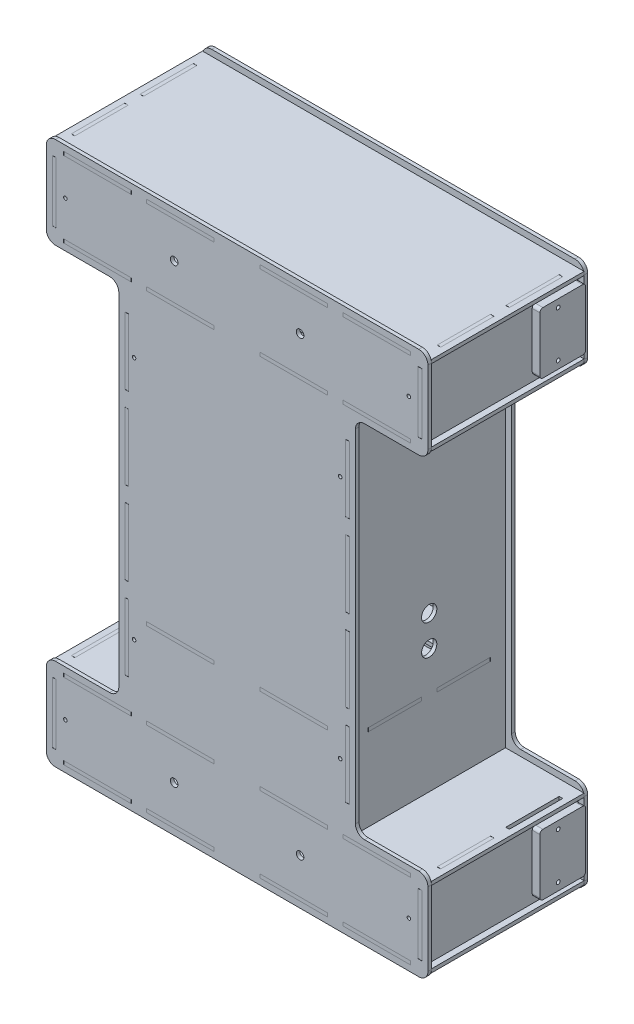
from build123d import *

# Parameters (mm, degrees)
SKETCH2_R           = 15.875
SKETCH2_R_2         = 1.4732
SKETCH2_W           = 56.2991
SKETCH2_H           = 2.9718
SKETCH2_W_2         = 2.9718
SKETCH2_H_2         = 50.8
SKETCH2_H_3         = 55.88
BOSS_EXTRUDE1_DEPTH = 2.9718
FILLET1_R           = 7.62
SKETCH3_R           = 3.175
SKETCH3_R_2         = 1.4732
SKETCH3_W           = 56.2991
SKETCH3_H           = 2.9718
SKETCH3_W_2         = 2.9718
SKETCH3_H_2         = 50.8
SKETCH3_H_3         = 55.88
BOSS_EXTRUDE2_DEPTH = 2.9718
SKETCH4_W           = 2.9718
SKETCH4_H           = 44.45
BOSS_EXTRUDE4_DEPTH = 2.9718
LPATTERN1_COUNT     = 2
LPATTERN1_PITCH     = 63.0682
SKETCH6_W           = 2.9718
SKETCH6_H           = 44.45
CUT_EXTRUDE1_DEPTH  = 433.729975037
CUT_EXTRUDE2_DEPTH  = 433.729975037
BOSS_EXTRUDE5_DEPTH = 2.9718
SKETCH15_W          = 38.1
SKETCH15_H          = 50.8
SKETCH15_R          = 1.5875
BOSS_EXTRUDE9_DEPTH = 6.35
SKETCH16_R          = 1.5875
CUT_EXTRUDE7_DEPTH  = 407.9423163
FILLET2_R           = 2.54
BOSS_EXTRUDE6_DEPTH = 2.9718
SKETCH10_W          = 44.45
SKETCH10_H          = 2.9718
CUT_EXTRUDE3_DEPTH  = 364.578898755
BOSS_EXTRUDE7_DEPTH = 2.9718
SKETCH12_R          = 1.4732
CUT_EXTRUDE4_DEPTH  = 372.829608394
CUT_EXTRUDE5_DEPTH  = 372.829608394
SKETCH14_R          = 6.35
SKETCH14_R_2        = 1.8288
CUT_EXTRUDE6_DEPTH  = 434.197494447
SKETCH17_R          = 1.4732
CUT_EXTRUDE8_DEPTH  = 308.21901761
SKETCH19_R          = 6.35
CUT_EXTRUDE9_DEPTH  = 362.514241769


with BuildPart() as part:
    # Sketch2 → Boss-Extrude1 (new body)
    with BuildSketch(Plane.XY):
        Polygon((-98.425, 149.86), (-98.425, -149.86), (-158.75, -149.86), (-158.75, -226.06), (158.75, -226.06), (158.75, -149.86), (98.425, -149.86), (98.425, 149.86), (158.75, 149.86), (158.75, 226.06), (-158.75, 226.06), (-158.75, 149.86), align=None)
        with Locations((66.675, 187.96)):
            Circle(SKETCH2_R, mode=Mode.SUBTRACT)
        with Locations((22.225, 187.96)):
            Circle(SKETCH2_R, mode=Mode.SUBTRACT)
        with Locations((-22.225, 187.96)):
            Circle(SKETCH2_R, mode=Mode.SUBTRACT)
        with Locations((-66.675, 187.96)):
            Circle(SKETCH2_R, mode=Mode.SUBTRACT)
        with Locations((111.125, 187.96)):
            Circle(SKETCH2_R, mode=Mode.SUBTRACT)
        with Locations((-111.125, 187.96)):
            Circle(SKETCH2_R, mode=Mode.SUBTRACT)
        with Locations((-22.225, -187.96)):
            Circle(SKETCH2_R, mode=Mode.SUBTRACT)
        with Locations((22.225, -187.96)):
            Circle(SKETCH2_R, mode=Mode.SUBTRACT)
        with Locations((66.675, -187.96)):
            Circle(SKETCH2_R, mode=Mode.SUBTRACT)
        with Locations((111.125, -187.96)):
            Circle(SKETCH2_R, mode=Mode.SUBTRACT)
        with Locations((-142.875, 187.96)):
            Circle(SKETCH2_R_2, mode=Mode.SUBTRACT)
        with Locations((-111.125, -187.96)):
            Circle(SKETCH2_R, mode=Mode.SUBTRACT)
        with Locations((-66.675, -187.96)):
            Circle(SKETCH2_R, mode=Mode.SUBTRACT)
        with Locations((142.875, 187.96)):
            Circle(SKETCH2_R_2, mode=Mode.SUBTRACT)
        with Locations((142.875, -187.96)):
            Circle(SKETCH2_R_2, mode=Mode.SUBTRACT)
        with Locations((-142.875, -187.96)):
            Circle(SKETCH2_R_2, mode=Mode.SUBTRACT)
        with Locations((-116.19865, 156.4259)):
            Rectangle(SKETCH2_W, SKETCH2_H, mode=Mode.SUBTRACT)
        with Locations((-152.1841, 187.96)):
            Rectangle(SKETCH2_W_2, SKETCH2_H_2, mode=Mode.SUBTRACT)
        with Locations((-47.19955, 156.4259)):
            Rectangle(SKETCH2_W, SKETCH2_H, mode=Mode.SUBTRACT)
        with Locations((-116.19865, 219.4941)):
            Rectangle(SKETCH2_W, SKETCH2_H, mode=Mode.SUBTRACT)
        with Locations((116.19865, 156.4259)):
            Rectangle(SKETCH2_W, SKETCH2_H, mode=Mode.SUBTRACT)
        with Locations((152.1841, 187.96)):
            Rectangle(SKETCH2_W_2, SKETCH2_H_2, mode=Mode.SUBTRACT)
        with Locations((47.19955, 219.4941)):
            Rectangle(SKETCH2_W, SKETCH2_H, mode=Mode.SUBTRACT)
        with Locations((152.1841, -187.96)):
            Rectangle(SKETCH2_W_2, SKETCH2_H_2, mode=Mode.SUBTRACT)
        with Locations((47.19955, 156.4259)):
            Rectangle(SKETCH2_W, SKETCH2_H, mode=Mode.SUBTRACT)
        with Locations((-116.19865, -156.4259)):
            Rectangle(SKETCH2_W, SKETCH2_H, mode=Mode.SUBTRACT)
        with Locations((-47.19955, -156.4259)):
            Rectangle(SKETCH2_W, SKETCH2_H, mode=Mode.SUBTRACT)
        with Locations((47.19955, -156.4259)):
            Rectangle(SKETCH2_W, SKETCH2_H, mode=Mode.SUBTRACT)
        with Locations((116.19865, -156.4259)):
            Rectangle(SKETCH2_W, SKETCH2_H, mode=Mode.SUBTRACT)
        with Locations((-91.8591, 34.29)):
            Rectangle(SKETCH2_W_2, SKETCH2_H_3, mode=Mode.SUBTRACT)
        with Locations((-91.8591, 102.87)):
            Rectangle(SKETCH2_W_2, SKETCH2_H_3, mode=Mode.SUBTRACT)
        with Locations((-116.19865, -219.4941)):
            Rectangle(SKETCH2_W, SKETCH2_H, mode=Mode.SUBTRACT)
        with Locations((-152.1841, -187.96)):
            Rectangle(SKETCH2_W_2, SKETCH2_H_2, mode=Mode.SUBTRACT)
        with Locations((91.8591, -102.87)):
            Rectangle(SKETCH2_W_2, SKETCH2_H_3, mode=Mode.SUBTRACT)
        with Locations((91.8591, -34.29)):
            Rectangle(SKETCH2_W_2, SKETCH2_H_3, mode=Mode.SUBTRACT)
        with Locations((91.8591, 102.87)):
            Rectangle(SKETCH2_W_2, SKETCH2_H_3, mode=Mode.SUBTRACT)
        with Locations((91.8591, 34.29)):
            Rectangle(SKETCH2_W_2, SKETCH2_H_3, mode=Mode.SUBTRACT)
        with Locations((-91.8591, -102.87)):
            Rectangle(SKETCH2_W_2, SKETCH2_H_3, mode=Mode.SUBTRACT)
        with Locations((-91.8591, -34.29)):
            Rectangle(SKETCH2_W_2, SKETCH2_H_3, mode=Mode.SUBTRACT)
        with Locations((-47.19955, 219.4941)):
            Rectangle(SKETCH2_W, SKETCH2_H, mode=Mode.SUBTRACT)
        with Locations((116.19865, 219.4941)):
            Rectangle(SKETCH2_W, SKETCH2_H, mode=Mode.SUBTRACT)
        with Locations((47.19955, -219.4941)):
            Rectangle(SKETCH2_W, SKETCH2_H, mode=Mode.SUBTRACT)
        with Locations((-47.19955, -219.4941)):
            Rectangle(SKETCH2_W, SKETCH2_H, mode=Mode.SUBTRACT)
        with Locations((116.19865, -219.4941)):
            Rectangle(SKETCH2_W, SKETCH2_H, mode=Mode.SUBTRACT)
        with Locations((47.19955, -84.8741)):
            Rectangle(SKETCH2_W, SKETCH2_H, mode=Mode.SUBTRACT)
        with Locations((-47.19955, -84.8741)):
            Rectangle(SKETCH2_W, SKETCH2_H, mode=Mode.SUBTRACT)
    extrude(amount=-BOSS_EXTRUDE1_DEPTH)

    # Fillet1
    fillet1_edges = [part.edges().sort_by_distance(p)[0] for p in [
        (-158.75, 226.06, -1.4859),
        (-158.75, 149.86, -1.4859),
        (-98.425, 149.86, -1.4859),
        (-98.425, -149.86, -1.4859),
        (-158.75, -149.86, -1.4859),
        (-158.75, -226.06, -1.4859),
        (158.75, -226.06, -1.4859),
        (158.75, -149.86, -1.4859),
        (98.425, -149.86, -1.4859),
        (98.425, 149.86, -1.4859),
        (158.75, 149.86, -1.4859),
        (158.75, 226.06, -1.4859),
    ]]
    fillet(fillet1_edges, radius=FILLET1_R)


with BuildPart() as body_2:
    # Sketch3 → Boss-Extrude2 (new body)
    with BuildSketch(Plane.XY.offset(127)):
        with BuildLine():
            Line((151.13, 226.06), (-151.13, 226.06))
            ThreePointArc((-151.13, 226.06), (-156.518153673, 223.828153673), (-158.75, 218.44))
            Line((-158.75, 218.44), (-158.75, 157.48))
            ThreePointArc((-158.75, 157.48), (-156.518153673, 152.091846327), (-151.13, 149.86))
            Line((-151.13, 149.86), (-106.045, 149.86))
            ThreePointArc((-106.045, 149.86), (-100.656846327, 147.628153673), (-98.425, 142.24))
            Line((-98.425, 142.24), (-98.425, -142.24))
            ThreePointArc((-98.425, -142.24), (-100.656846327, -147.628153673), (-106.045, -149.86))
            Line((-106.045, -149.86), (-151.13, -149.86))
            ThreePointArc((-151.13, -149.86), (-156.518153673, -152.091846327), (-158.75, -157.48))
            Line((-158.75, -157.48), (-158.75, -218.44))
            ThreePointArc((-158.75, -218.44), (-156.518153673, -223.828153673), (-151.13, -226.06))
            Line((-151.13, -226.06), (151.13, -226.06))
            ThreePointArc((151.13, -226.06), (156.518153673, -223.828153673), (158.75, -218.44))
            Line((158.75, -218.44), (158.75, -157.48))
            ThreePointArc((158.75, -157.48), (156.518153673, -152.091846327), (151.13, -149.86))
            Line((151.13, -149.86), (106.045, -149.86))
            ThreePointArc((106.045, -149.86), (100.656846327, -147.628153673), (98.425, -142.24))
            Line((98.425, -142.24), (98.425, 142.24))
            ThreePointArc((98.425, 142.24), (100.656846327, 147.628153673), (106.045, 149.86))
            Line((106.045, 149.86), (151.13, 149.86))
            ThreePointArc((151.13, 149.86), (156.518153673, 152.091846327), (158.75, 157.48))
            Line((158.75, 157.48), (158.75, 218.44))
            ThreePointArc((158.75, 218.44), (156.518153673, 223.828153673), (151.13, 226.06))
        make_face()
        with Locations((-52.3875, 187.96)):
            Circle(SKETCH3_R, mode=Mode.SUBTRACT)
        with Locations((52.3875, 187.96)):
            Circle(SKETCH3_R, mode=Mode.SUBTRACT)
        with Locations((52.3875, -187.96)):
            Circle(SKETCH3_R, mode=Mode.SUBTRACT)
        with Locations((-52.3875, -187.96)):
            Circle(SKETCH3_R, mode=Mode.SUBTRACT)
        with Locations((-142.875, 187.96)):
            Circle(SKETCH3_R_2, mode=Mode.SUBTRACT)
        with Locations((142.875, 187.96)):
            Circle(SKETCH3_R_2, mode=Mode.SUBTRACT)
        with Locations((142.875, -187.96)):
            Circle(SKETCH3_R_2, mode=Mode.SUBTRACT)
        with Locations((-142.875, -187.96)):
            Circle(SKETCH3_R_2, mode=Mode.SUBTRACT)
        with Locations((-116.19865, 156.4259)):
            Rectangle(SKETCH3_W, SKETCH3_H, mode=Mode.SUBTRACT)
        with Locations((-152.1841, 187.96)):
            Rectangle(SKETCH3_W_2, SKETCH3_H_2, mode=Mode.SUBTRACT)
        with Locations((-47.19955, 156.4259)):
            Rectangle(SKETCH3_W, SKETCH3_H, mode=Mode.SUBTRACT)
        with Locations((-116.19865, 219.4941)):
            Rectangle(SKETCH3_W, SKETCH3_H, mode=Mode.SUBTRACT)
        with Locations((47.19955, 219.4941)):
            Rectangle(SKETCH3_W, SKETCH3_H, mode=Mode.SUBTRACT)
        with Locations((116.19865, 156.4259)):
            Rectangle(SKETCH3_W, SKETCH3_H, mode=Mode.SUBTRACT)
        with Locations((152.1841, 187.96)):
            Rectangle(SKETCH3_W_2, SKETCH3_H_2, mode=Mode.SUBTRACT)
        with Locations((-47.19955, 219.4941)):
            Rectangle(SKETCH3_W, SKETCH3_H, mode=Mode.SUBTRACT)
        with Locations((152.1841, -187.96)):
            Rectangle(SKETCH3_W_2, SKETCH3_H_2, mode=Mode.SUBTRACT)
        with Locations((47.19955, 156.4259)):
            Rectangle(SKETCH3_W, SKETCH3_H, mode=Mode.SUBTRACT)
        with Locations((-116.19865, -156.4259)):
            Rectangle(SKETCH3_W, SKETCH3_H, mode=Mode.SUBTRACT)
        with Locations((-47.19955, -156.4259)):
            Rectangle(SKETCH3_W, SKETCH3_H, mode=Mode.SUBTRACT)
        with Locations((47.19955, -156.4259)):
            Rectangle(SKETCH3_W, SKETCH3_H, mode=Mode.SUBTRACT)
        with Locations((116.19865, -156.4259)):
            Rectangle(SKETCH3_W, SKETCH3_H, mode=Mode.SUBTRACT)
        with Locations((-91.8591, 34.29)):
            Rectangle(SKETCH3_W_2, SKETCH3_H_3, mode=Mode.SUBTRACT)
        with Locations((-91.8591, 102.87)):
            Rectangle(SKETCH3_W_2, SKETCH3_H_3, mode=Mode.SUBTRACT)
        with Locations((-152.1841, -187.96)):
            Rectangle(SKETCH3_W_2, SKETCH3_H_2, mode=Mode.SUBTRACT)
        with Locations((91.8591, -102.87)):
            Rectangle(SKETCH3_W_2, SKETCH3_H_3, mode=Mode.SUBTRACT)
        with Locations((91.8591, -34.29)):
            Rectangle(SKETCH3_W_2, SKETCH3_H_3, mode=Mode.SUBTRACT)
        with Locations((91.8591, 102.87)):
            Rectangle(SKETCH3_W_2, SKETCH3_H_3, mode=Mode.SUBTRACT)
        with Locations((91.8591, 34.29)):
            Rectangle(SKETCH3_W_2, SKETCH3_H_3, mode=Mode.SUBTRACT)
        with Locations((-91.8591, -102.87)):
            Rectangle(SKETCH3_W_2, SKETCH3_H_3, mode=Mode.SUBTRACT)
        with Locations((-91.8591, -34.29)):
            Rectangle(SKETCH3_W_2, SKETCH3_H_3, mode=Mode.SUBTRACT)
        with Locations((116.19865, 219.4941)):
            Rectangle(SKETCH3_W, SKETCH3_H, mode=Mode.SUBTRACT)
        with Locations((116.19865, -219.4941)):
            Rectangle(SKETCH3_W, SKETCH3_H, mode=Mode.SUBTRACT)
        with Locations((47.19955, -219.4941)):
            Rectangle(SKETCH3_W, SKETCH3_H, mode=Mode.SUBTRACT)
        with Locations((-47.19955, -219.4941)):
            Rectangle(SKETCH3_W, SKETCH3_H, mode=Mode.SUBTRACT)
        with Locations((-116.19865, -219.4941)):
            Rectangle(SKETCH3_W, SKETCH3_H, mode=Mode.SUBTRACT)
        with Locations((-47.19955, -84.8741)):
            Rectangle(SKETCH3_W, SKETCH3_H, mode=Mode.SUBTRACT)
        with Locations((47.19955, -84.8741)):
            Rectangle(SKETCH3_W, SKETCH3_H, mode=Mode.SUBTRACT)
    extrude(amount=BOSS_EXTRUDE2_DEPTH)


with BuildPart() as body_3:
    # Sketch4 → Boss-Extrude4 (new body)
    with BuildSketch(Plane(origin=(0, 218.0082, 0), x_dir=(1, 0, 0), z_dir=(0, 1, 0))):
        Polygon((-144.2212, -127), (-144.2212, -129.9718), (-88.1761, -129.9718), (-88.1761, -127), (-75.2221, -127), (-75.2221, -129.9718), (-19.177, -129.9718), (-19.177, -127), (19.177, -127), (19.177, -129.9718), (75.2221, -129.9718), (75.2221, -127), (88.1761, -127), (88.1761, -129.9718), (144.2212, -129.9718), (144.2212, -127), (158.75, -127), (158.75, 0), (144.2212, 0), (144.2212, 2.9718), (88.1761, 2.9718), (88.1761, 0), (75.2221, 0), (75.2221, 2.9718), (19.177, 2.9718), (19.177, 0), (-19.177, 0), (-19.177, 2.9718), (-75.2221, 2.9718), (-75.2221, 0), (-88.0491, 0), (-88.1761, 0), (-144.2212, 0), (-144.3482, 0), (-158.75, 0), (-158.75, -127), align=None)
        with Locations((-152.1841, -92.075)):
            Rectangle(SKETCH4_W, SKETCH4_H, mode=Mode.SUBTRACT)
        with Locations((152.1841, -92.075)):
            Rectangle(SKETCH4_W, SKETCH4_H, mode=Mode.SUBTRACT)
        with Locations((-152.1841, -34.925)):
            Rectangle(SKETCH4_W, SKETCH4_H, mode=Mode.SUBTRACT)
        with Locations((152.1841, -34.925)):
            Rectangle(SKETCH4_W, SKETCH4_H, mode=Mode.SUBTRACT)
    extrude(amount=BOSS_EXTRUDE4_DEPTH)


with BuildPart() as lpattern1_1:
    # LPattern1: pattern copy
    add(body_3.part.moved(Location(Vector(0, -1, 0) * (1 * LPATTERN1_PITCH))))

    # Sketch6 → Cut-Extrude1 (cut, through all)
    with BuildSketch(Plane.XZ.offset(-154.94)):
        with Locations((-91.8591, 34.925)):
            Rectangle(SKETCH6_W, SKETCH6_H)
        with Locations((-91.8591, 92.075)):
            Rectangle(SKETCH6_W, SKETCH6_H)
        with Locations((91.8591, 92.075)):
            Rectangle(SKETCH6_W, SKETCH6_H)
        with Locations((91.8591, 34.925)):
            Rectangle(SKETCH6_W, SKETCH6_H)
    extrude(amount=-CUT_EXTRUDE1_DEPTH, mode=Mode.SUBTRACT)

    # Sketch8 → Cut-Extrude2 (cut, through all)
    with BuildSketch(Plane.XZ.offset(-154.94)):
        with BuildLine():
            Line((-61.11875, 65.88125), (61.11875, 65.88125))
            ThreePointArc((61.11875, 65.88125), (63.5, 63.5), (61.11875, 61.11875))
            Line((61.11875, 61.11875), (-61.11875, 61.11875))
            ThreePointArc((-61.11875, 61.11875), (-63.5, 63.5), (-61.11875, 65.88125))
        make_face()
        with BuildLine():
            Line((-61.11875, 78.26375), (61.11875, 78.26375))
            ThreePointArc((61.11875, 78.26375), (63.5, 75.8825), (61.11875, 73.50125))
            Line((61.11875, 73.50125), (-61.11875, 73.50125))
            ThreePointArc((-61.11875, 73.50125), (-63.5, 75.8825), (-61.11875, 78.26375))
        make_face()
        with BuildLine():
            Line((-61.11875, 90.64625), (61.11875, 90.64625))
            ThreePointArc((61.11875, 90.64625), (63.5, 88.265), (61.11875, 85.88375))
            Line((61.11875, 85.88375), (-61.11875, 85.88375))
            ThreePointArc((-61.11875, 85.88375), (-63.5, 88.265), (-61.11875, 90.64625))
        make_face()
        with BuildLine():
            Line((-61.11875, 103.02875), (61.11875, 103.02875))
            ThreePointArc((61.11875, 103.02875), (63.5, 100.6475), (61.11875, 98.26625))
            Line((61.11875, 98.26625), (-61.11875, 98.26625))
            ThreePointArc((-61.11875, 98.26625), (-63.5, 100.6475), (-61.11875, 103.02875))
        make_face()
        with BuildLine():
            Line((-61.11875, 115.41125), (61.11875, 115.41125))
            ThreePointArc((61.11875, 115.41125), (63.5, 113.03), (61.11875, 110.64875))
            Line((61.11875, 110.64875), (-61.11875, 110.64875))
            ThreePointArc((-61.11875, 110.64875), (-63.5, 113.03), (-61.11875, 115.41125))
        make_face()
        with BuildLine():
            Line((-61.11875, 53.49875), (61.11875, 53.49875))
            ThreePointArc((61.11875, 53.49875), (63.5, 51.1175), (61.11875, 48.73625))
            Line((61.11875, 48.73625), (-61.11875, 48.73625))
            ThreePointArc((-61.11875, 48.73625), (-63.5, 51.1175), (-61.11875, 53.49875))
        make_face()
        with BuildLine():
            Line((-61.11875, 41.11625), (61.11875, 41.11625))
            ThreePointArc((61.11875, 41.11625), (63.5, 38.735), (61.11875, 36.35375))
            Line((61.11875, 36.35375), (-61.11875, 36.35375))
            ThreePointArc((-61.11875, 36.35375), (-63.5, 38.735), (-61.11875, 41.11625))
        make_face()
        with BuildLine():
            Line((-61.11875, 28.73375), (61.11875, 28.73375))
            ThreePointArc((61.11875, 28.73375), (63.5, 26.3525), (61.11875, 23.97125))
            Line((61.11875, 23.97125), (-61.11875, 23.97125))
            ThreePointArc((-61.11875, 23.97125), (-63.5, 26.3525), (-61.11875, 28.73375))
        make_face()
        with BuildLine():
            Line((-61.11875, 16.35125), (61.11875, 16.35125))
            ThreePointArc((61.11875, 16.35125), (63.5, 13.97), (61.11875, 11.58875))
            Line((61.11875, 11.58875), (-61.11875, 11.58875))
            ThreePointArc((-61.11875, 11.58875), (-63.5, 13.97), (-61.11875, 16.35125))
        make_face()
    extrude(amount=-CUT_EXTRUDE2_DEPTH, mode=Mode.SUBTRACT)


with BuildPart() as body_5:
    # Mirror2: mirrored copy
    add(body_3.part.mirror(Plane.ZX))


with BuildPart() as body_6:
    # Mirror2 2: mirrored copy
    add(lpattern1_1.part.mirror(Plane.ZX))


with BuildPart() as body_7:
    # Sketch5 → Boss-Extrude5 (new body)
    with BuildSketch(Plane.ZY.offset(150.6982)):
        Polygon((57.023, 220.98), (12.827, 220.98), (12.827, 218.0082), (0, 218.0082), (0, 213.233), (-2.9718, 213.233), (-2.9718, 162.687), (0, 162.687), (0, 157.9118), (12.7, 157.9118), (12.827, 157.9118), (57.023, 157.9118), (57.15, 157.9118), (69.977, 157.9118), (69.977, 154.94), (114.173, 154.94), (114.173, 157.9118), (127, 157.9118), (127, 162.687), (129.9718, 162.687), (129.9718, 213.233), (127, 213.233), (127, 218.0082), (114.173, 218.0082), (114.173, 220.98), (69.977, 220.98), (69.977, 218.0082), (57.023, 218.0082), align=None)
    extrude(amount=BOSS_EXTRUDE5_DEPTH)

    # Sketch16 → Cut-Extrude7 (cut, through all)
    with BuildSketch(Plane.ZY.offset(153.67)):
        with Locations((22.86, 207.01)):
            Circle(SKETCH16_R)
        with Locations((22.86, 168.91)):
            Circle(SKETCH16_R)
    extrude(amount=-CUT_EXTRUDE7_DEPTH, mode=Mode.SUBTRACT)


with BuildPart() as body_8:
    # Sketch15 → Boss-Extrude9 (new body)
    with BuildSketch(Plane(origin=(-153.67, 0, 0), x_dir=(0, 0, -1), z_dir=(1, 0, 0))):
        with Locations((-19.05, 187.96)):
            Rectangle(SKETCH15_W, SKETCH15_H)
        with Locations((-22.86, 207.01)):
            Circle(SKETCH15_R, mode=Mode.SUBTRACT)
        with Locations((-22.86, 168.91)):
            Circle(SKETCH15_R, mode=Mode.SUBTRACT)
    extrude(amount=-BOSS_EXTRUDE9_DEPTH)

    # Fillet2
    fillet2_edges = [body_8.edges().sort_by_distance(p)[0] for p in [
        (-156.845, 162.56, 0),
        (-156.845, 162.56, 38.1),
        (-156.845, 213.36, 38.1),
        (-156.845, 213.36, 0),
    ]]
    fillet(fillet2_edges, radius=FILLET2_R)


with BuildPart() as body_9:
    # Mirror3: mirrored copy
    add(body_7.part.mirror(Plane(origin=(0, 0, 0), x_dir=(0, 0, 1), z_dir=(1, 0, 0))))


with BuildPart() as body_10:
    # Mirror3 2: mirrored copy
    add(body_8.part.mirror(Plane(origin=(0, 0, 0), x_dir=(0, 0, 1), z_dir=(1, 0, 0))))


with BuildPart() as body_11:
    # Mirror4: mirrored copy
    add(body_7.part.mirror(Plane.ZX))


with BuildPart() as body_12:
    # Mirror4 2: mirrored copy
    add(body_9.part.mirror(Plane.ZX))


with BuildPart() as body_13:
    # Mirror4 3: mirrored copy
    add(body_8.part.mirror(Plane.ZX))


with BuildPart() as body_14:
    # Mirror4 4: mirrored copy
    add(body_10.part.mirror(Plane.ZX))


with BuildPart() as body_15:
    # Sketch7 → Boss-Extrude6 (new body)
    with BuildSketch(Plane.ZY.offset(90.3732)):
        Polygon((129.9718, 75.057), (129.9718, 130.683), (127, 130.683), (127, 154.94), (114.173, 154.94), (114.173, 157.9118), (69.977, 157.9118), (69.977, 154.94), (57.023, 154.94), (57.023, 157.9118), (12.827, 157.9118), (12.827, 154.94), (0, 154.94), (0, 130.683), (-2.9718, 130.683), (-2.9718, 75.057), (0, 75.057), (0, 62.103), (-2.9718, 62.103), (-2.9718, 6.477), (0, 6.477), (0, -6.477), (-2.9718, -6.477), (-2.9718, -62.103), (0, -62.103), (0, -75.057), (-2.9718, -75.057), (-2.9718, -130.683), (0, -130.683), (0, -154.94), (12.827, -154.94), (12.827, -157.9118), (57.023, -157.9118), (57.023, -154.94), (69.977, -154.94), (69.977, -157.9118), (114.173, -157.9118), (114.173, -154.94), (127, -154.94), (127, -130.683), (129.9718, -130.683), (129.9718, -75.057), (127, -75.057), (127, -62.103), (129.9718, -62.103), (129.9718, -6.477), (127, -6.477), (127, 6.477), (129.9718, 6.477), (129.9718, 62.103), (127, 62.103), (127, 75.057), align=None)
    extrude(amount=BOSS_EXTRUDE6_DEPTH)

    # Sketch10 → Cut-Extrude3 (cut, through all)
    with BuildSketch(Plane.ZY.offset(93.345)):
        with Locations((34.925, -84.8741)):
            Rectangle(SKETCH10_W, SKETCH10_H)
        with Locations((92.075, -84.8741)):
            Rectangle(SKETCH10_W, SKETCH10_H)
    extrude(amount=-CUT_EXTRUDE3_DEPTH, mode=Mode.SUBTRACT)


with BuildPart() as body_16:
    # Mirror5: mirrored copy
    add(body_15.part.mirror(Plane(origin=(0, 0, 0), x_dir=(0, 0, 1), z_dir=(1, 0, 0))))

    # Sketch19 → Cut-Extrude9 (cut, through all)
    with BuildSketch(Plane(origin=(-90.3732, 0, 0), x_dir=(0, 0, -1), z_dir=(1, 0, 0))):
        with Locations((-63.5, -51.6382)):
            Circle(SKETCH19_R)
        with Locations((-63.5, -26.2382)):
            Circle(SKETCH19_R)
    extrude(amount=CUT_EXTRUDE9_DEPTH, mode=Mode.SUBTRACT)


with BuildPart() as body_17:
    # Sketch11 → Boss-Extrude7 (new body)
    with BuildSketch(Plane(origin=(0, -86.36, 0), x_dir=(1, 0, 0), z_dir=(0, 1, 0))):
        Polygon((19.177, -129.9718), (75.2221, -129.9718), (75.2221, -127), (90.3732, -127), (90.3732, -114.173), (93.345, -114.173), (93.345, -69.977), (90.3732, -69.977), (90.3732, -57.023), (93.345, -57.023), (93.345, -12.827), (90.3732, -12.827), (90.3732, 0), (75.2221, 0), (75.2221, 2.9718), (19.177, 2.9718), (19.177, 0), (-19.177, 0), (-19.177, 2.9718), (-75.2221, 2.9718), (-75.2221, 0), (-90.3732, 0), (-90.3732, -12.827), (-93.345, -12.827), (-93.345, -57.023), (-90.3732, -57.023), (-90.3732, -69.977), (-93.345, -69.977), (-93.345, -114.173), (-90.3732, -114.173), (-90.3732, -127), (-75.2221, -127), (-75.2221, -129.9718), (-19.177, -129.9718), (-19.177, -127), (19.177, -127), align=None)
    extrude(amount=BOSS_EXTRUDE7_DEPTH)

    # Sketch12 → Cut-Extrude4 (cut, through all)
    with BuildSketch(Plane(origin=(0, -83.3882, 0), x_dir=(1, 0, 0), z_dir=(0, 1, 0))):
        with Locations((-52.5145, -10.9855)):
            Circle(SKETCH12_R)
        with Locations((52.5145, -10.9855)):
            Circle(SKETCH12_R)
        with Locations((52.5145, -116.0145)):
            Circle(SKETCH12_R)
        with Locations((-52.5145, -116.0145)):
            Circle(SKETCH12_R)
    extrude(amount=-CUT_EXTRUDE4_DEPTH, mode=Mode.SUBTRACT)

    # Sketch13 → Cut-Extrude5 (cut, through all)
    with BuildSketch(Plane(origin=(0, -83.3882, 0), x_dir=(1, 0, 0), z_dir=(0, 1, 0))):
        with BuildLine():
            Line((-61.11875, -61.11875), (61.11875, -61.11875))
            ThreePointArc((61.11875, -61.11875), (63.5, -63.5), (61.11875, -65.88125))
            Line((61.11875, -65.88125), (-61.11875, -65.88125))
            ThreePointArc((-61.11875, -65.88125), (-63.5, -63.5), (-61.11875, -61.11875))
        make_face()
        with BuildLine():
            Line((-61.11875, -49.68875), (61.11875, -49.68875))
            ThreePointArc((61.11875, -49.68875), (63.5, -52.07), (61.11875, -54.45125))
            Line((61.11875, -54.45125), (-61.11875, -54.45125))
            ThreePointArc((-61.11875, -54.45125), (-63.5, -52.07), (-61.11875, -49.68875))
        make_face()
        with BuildLine():
            Line((-61.11875, -38.25875), (61.11875, -38.25875))
            ThreePointArc((61.11875, -38.25875), (63.5, -40.64), (61.11875, -43.02125))
            Line((61.11875, -43.02125), (-61.11875, -43.02125))
            ThreePointArc((-61.11875, -43.02125), (-63.5, -40.64), (-61.11875, -38.25875))
        make_face()
        with BuildLine():
            Line((-61.11875, -26.82875), (61.11875, -26.82875))
            ThreePointArc((61.11875, -26.82875), (63.5, -29.21), (61.11875, -31.59125))
            Line((61.11875, -31.59125), (-61.11875, -31.59125))
            ThreePointArc((-61.11875, -31.59125), (-63.5, -29.21), (-61.11875, -26.82875))
        make_face()
        with BuildLine():
            Line((-61.11875, -15.39875), (61.11875, -15.39875))
            ThreePointArc((61.11875, -15.39875), (63.5, -17.78), (61.11875, -20.16125))
            Line((61.11875, -20.16125), (-61.11875, -20.16125))
            ThreePointArc((-61.11875, -20.16125), (-63.5, -17.78), (-61.11875, -15.39875))
        make_face()
        with BuildLine():
            Line((-61.11875, -72.54875), (61.11875, -72.54875))
            ThreePointArc((61.11875, -72.54875), (63.5, -74.93), (61.11875, -77.31125))
            Line((61.11875, -77.31125), (-61.11875, -77.31125))
            ThreePointArc((-61.11875, -77.31125), (-63.5, -74.93), (-61.11875, -72.54875))
        make_face()
        with BuildLine():
            Line((-61.11875, -83.97875), (61.11875, -83.97875))
            ThreePointArc((61.11875, -83.97875), (63.5, -86.36), (61.11875, -88.74125))
            Line((61.11875, -88.74125), (-61.11875, -88.74125))
            ThreePointArc((-61.11875, -88.74125), (-63.5, -86.36), (-61.11875, -83.97875))
        make_face()
        with BuildLine():
            Line((-61.11875, -95.40875), (61.11875, -95.40875))
            ThreePointArc((61.11875, -95.40875), (63.5, -97.79), (61.11875, -100.17125))
            Line((61.11875, -100.17125), (-61.11875, -100.17125))
            ThreePointArc((-61.11875, -100.17125), (-63.5, -97.79), (-61.11875, -95.40875))
        make_face()
        with BuildLine():
            Line((-61.11875, -106.83875), (61.11875, -106.83875))
            ThreePointArc((61.11875, -106.83875), (63.5, -109.22), (61.11875, -111.60125))
            Line((61.11875, -111.60125), (-61.11875, -111.60125))
            ThreePointArc((-61.11875, -111.60125), (-63.5, -109.22), (-61.11875, -106.83875))
        make_face()
    extrude(amount=-CUT_EXTRUDE5_DEPTH, mode=Mode.SUBTRACT)


with BuildPart() as lpattern1_1_1:
    add(lpattern1_1.part)

    # Sketch14 → Cut-Extrude6 (cut, through all)
    with BuildSketch(Plane(origin=(0, 154.94, 0), x_dir=(1, 0, 0), z_dir=(0, 1, 0))):
        with Locations((127, -63.5)):
            Circle(SKETCH14_R)
        with Locations((127, -50.8)):
            Circle(SKETCH14_R_2)
        with Locations((127, -76.2)):
            Circle(SKETCH14_R_2)
        with Locations((-127, -76.2)):
            Circle(SKETCH14_R_2)
        with Locations((-127, -63.5)):
            Circle(SKETCH14_R)
        with Locations((-127, -50.8)):
            Circle(SKETCH14_R_2)
    extrude(amount=CUT_EXTRUDE6_DEPTH, mode=Mode.SUBTRACT)


with BuildPart() as cut_extrude8_tool:
    # Sketch17 → Cut-Extrude8 (new, through all)
    with BuildSketch(Plane(origin=(0, 0, -2.9718), x_dir=(-1, 0, 0), z_dir=(0, 0, -1))):
        with Locations((-85.725, 101.6)):
            Circle(SKETCH17_R)
        with Locations((85.725, 101.6)):
            Circle(SKETCH17_R)
        with Locations((-85.725, -101.6)):
            Circle(SKETCH17_R)
        with Locations((85.725, -101.6)):
            Circle(SKETCH17_R)
    extrude(amount=-CUT_EXTRUDE8_DEPTH)


with BuildPart() as part_1:
    add(part.part)

    # Cut-Extrude8: cut by cut_extrude8_tool
    add(cut_extrude8_tool.part, mode=Mode.SUBTRACT)


with BuildPart() as body_2_1:
    add(body_2.part)

    # Cut-Extrude8: cut by cut_extrude8_tool
    add(cut_extrude8_tool.part, mode=Mode.SUBTRACT)


solid = Compound([body_3.part, body_5.part, body_6.part, body_7.part, body_8.part, body_9.part, body_10.part, body_11.part, body_12.part, body_13.part, body_14.part, body_15.part, body_16.part, body_17.part, lpattern1_1_1.part, part_1.part, body_2_1.part])
